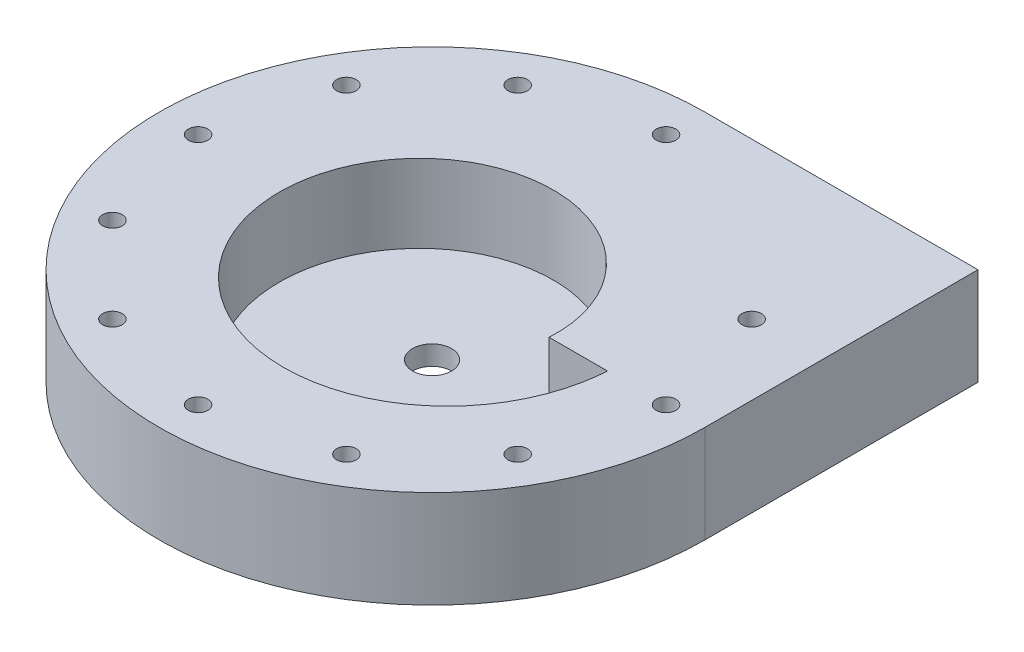
from build123d import *

# Parameters (mm, degrees)
SKETCH1_R           = 6.35
BOSS_EXTRUDE1_DEPTH = 31.75
SKETCH1_3_R         = 6.35
CUT_EXTRUDE1_DEPTH  = 25.4
SKETCH2_R           = 7.9375
CUT_EXTRUDE3_DEPTH  = 130.670669527
CIRPATTERN1_COUNT   = 12


with BuildPart() as part:
    # Sketch1 → Boss-Extrude1 (new body)
    with BuildSketch(Plane(origin=(0, 0, 0), x_dir=(1, 0, 0), z_dir=(0, 1, 0))):
        with BuildLine():
            ThreePointArc((0, 88.9), (-62.861792847, -62.861792847), (88.9, 0))
            Line((88.9, 0), (88.9, 88.9))
            Line((88.9, 88.9), (0, 88.9))
        make_face()
        Circle(SKETCH1_R, mode=Mode.SUBTRACT)
    extrude(amount=-BOSS_EXTRUDE1_DEPTH)

    # Sketch1<3> → Cut-Extrude1 (cut)
    with BuildSketch(Plane(origin=(0, 0, 0), x_dir=(1, 0, 0), z_dir=(0, 1, 0))):
        with BuildLine():
            Line((57.15, 0), (38.1, 0))
            add(Edge.make_bspline(
                [(38.1, 0), (38.104196567, 0.065031023), (38.112207842, 0.195583217), (38.126176664, 0.440876384), (38.142557673, 0.771571842), (38.157990518, 1.154772047), (38.171235997, 1.609607179), (38.18022516, 2.15183656), (38.180190318, 2.76477533), (38.16804129, 3.534196816), (38.13367419, 4.455490045), (38.064990608, 5.529852502), (37.94733507, 6.754027907), (37.790772544, 7.974123243), (37.59551179, 9.188459972), (37.361845774, 10.396093414), (37.090076945, 11.595666722), (36.780560568, 12.786094619), (36.260236212, 14.556182345), (35.443319711, 16.878013492), (34.088815499, 19.982231826), (31.963759605, 23.735168412), (29.245000433, 27.474707072), (25.878653124, 31.078416043), (22.0996836, 34.246463382), (18.483254371, 36.599725785), (14.65406305, 38.578465889), (11.219997335, 39.940895185), (8.27762035, 40.846700338), (4.675198716, 41.652734243), (1.018009014, 42.175168222), (-3.291665868, 42.367557332), (-8.209284316, 42.016659331), (-14.265134938, 40.875799714), (-21.261056783, 38.415136223), (-28.766203683, 34.052617532), (-35.122018503, 28.142758143), (-39.541648876, 22.191549685), (-43.048568006, 15.683142056), (-45.652341593, 8.564743047), (-47.130961496, -0.156773943), (-46.654939217, -10.228831884), (-44.071271342, -19.968233563), (-39.637925815, -28.827244651), (-33.518294109, -36.615159209), (-25.978437857, -43.035344671), (-17.329782279, -47.855782201), (-7.914273637, -50.91406318), (1.910318107, -52.11920776), (10.550224055, -51.534251172), (17.769170061, -49.890863591), (23.558783215, -47.793736069), (28.016093606, -45.696339569), (32.262421993, -43.199462389), (36.263637699, -40.3262584), (39.988195882, -37.102621238), (43.407390273, -33.55683764), (46.881470053, -29.239634434), (50.225624146, -24.064277187), (52.939544538, -18.526670086), (54.9867334, -12.715379226), (56.071373835, -8.227057535), (56.571947712, -5.347902309), (56.815829191, -3.519331752), (56.906489986, -2.755987253), (56.964145411, -2.221752433), (57.00967148, -1.759974767), (57.044461814, -1.381162984), (57.070496253, -1.08031027), (57.101694319, -0.693015395), (57.128353891, -0.322618205), (57.141606855, -0.130062207), (57.15, 0)],
                knots=[0.067378542, 0.067378542, 0.067378542, 0.067378542, 0.067378542, 0.068259712, 0.069140882, 0.070022052, 0.070903222, 0.072665563, 0.074427903, 0.076190244, 0.077952584, 0.081477265, 0.085001946, 0.088526627, 0.092051307, 0.095575988, 0.099100674, 0.102625359, 0.106150045, 0.109674731, 0.120248788, 0.130822843, 0.144921582, 0.159020328, 0.17311908, 0.187217836, 0.201316597, 0.208365977, 0.222464731, 0.229514108, 0.236563485, 0.250662246, 0.264761007, 0.278859756, 0.292958504, 0.32115599, 0.349353479, 0.377550966, 0.391649728, 0.40574849, 0.433946009, 0.464056799, 0.492254247, 0.520451696, 0.548649173, 0.576846649, 0.605044111, 0.633241573, 0.661439034, 0.689636495, 0.717833968, 0.731932705, 0.746031441, 0.760130179, 0.774228916, 0.788327653, 0.802426391, 0.816525136, 0.83062388, 0.851771998, 0.872920111, 0.887018851, 0.901117592, 0.904642277, 0.906404619, 0.908166962, 0.909929305, 0.910810476, 0.911691647, 0.912572818, 0.91345399, 0.915216332, 0.915216332, 0.915216332, 0.915216332, 0.915216332], degree=4))
        make_face()
        Circle(SKETCH1_3_R, mode=Mode.SUBTRACT)
    extrude(amount=-CUT_EXTRUDE1_DEPTH, mode=Mode.SUBTRACT)

    # Sketch2 → Cut-Extrude3 (cut, through all)
    with BuildSketch(Plane.XY):
        with Locations((49.2125, -17.4625)):
            Circle(SKETCH2_R)
    extrude(amount=-CUT_EXTRUDE3_DEPTH, mode=Mode.SUBTRACT)

    # Sketch3 → 1/4 (0.25) Diameter Hole1 (revolve, cut)
    with BuildSketch(Plane(origin=(76.2, 0, 0), x_dir=(0, 0, 1), z_dir=(1, 0, 0))):
        Polygon((0, 0), (0, 78.107732465), (3.175, 76.2), (3.175, 0), align=None)
    f_1_4_0_25_diameter_hole1 = revolve(axis=Axis((76.2, 6.35, 0), (0, -1, 0)), mode=Mode.SUBTRACT)

    # CirPattern1: 1/4 (0.25) Diameter Hole1 ×12 about axis, 1 skipped
    cirpattern1_axis = Axis((0, -31.75, 0), (0, 1, 0))
    add([f_1_4_0_25_diameter_hole1.rotate(cirpattern1_axis, i * 360 / CIRPATTERN1_COUNT) for i in range(1, CIRPATTERN1_COUNT) if i not in (2,)], mode=Mode.SUBTRACT)


solid = part.part
